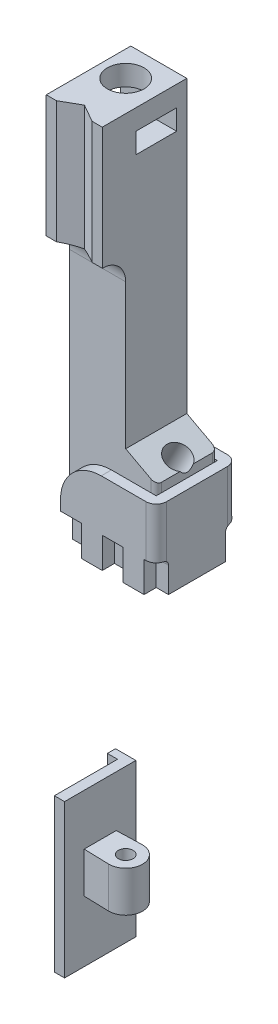
from build123d import *

# Parameters (mm, degrees)
SHUTTLECHANNELOUTLINE_W                = 2.75
SHUTTLECHANNELOUTLINE_H                = 4
SHUTTLECHANNELBODY_EXTRUDE_DEPTH       = 14
SKETCH23_R                             = 0.425
SHUTTLECHANNELCAP_EXTRUDE1_DEPTH       = 1
SKETCH22_RX                            = 1.3
SKETCH22_RY                            = 0.65
SHUTTLECHANNELCAP_EXTRUDE2_DEPTH       = 0.5
SKETCH24_R                             = 0.65
SHUTTLECHANNELCAP_EXTRUDE3_DEPTH       = 0.5
SKETCH26_R                             = 0.25
SHUTTLECHANNELCAP_INJECTIONHOLE_DEPTH  = 24.992186228
CHANNEL_CUT_EXTRUDE12_DEPTH            = 14
CHANNEL_CUT_EXTRUDE12_DEPTH_BACK       = 5
BOSS_EXTRUDE1_DEPTH                    = 4
SKETCH31_W                             = 4.25
SKETCH31_H                             = 0.5
CUT_EXTRUDE3_DEPTH                     = 18.036725037
SKETCH29_W                             = 2.75
SKETCH29_H                             = 5
BOSS_EXTRUDE2_DEPTH                    = 1.15
SKETCH49_W                             = 2.75
SKETCH49_H                             = 4.15
SKETCH49_R                             = 0.9
BOSS_EXTRUDE10_DEPTH                   = 1
FILLET2_R                              = 1.15
SKETCH51_W                             = 2
SKETCH51_H                             = 1
CUT_EXTRUDE8_DEPTH                     = 26.251683112
CUT_EXTRUDE9_DEPTH                     = 19.063014699
SKETCH37_R                             = 0.375
SHUTTLEPLUG_DEPTH                      = 1.5
SKETCH38_W                             = 4.2
SKETCH38_H                             = 3
BOSS_EXTRUDE7_DEPTH                    = 0.5
BOSS_EXTRUDE8_DEPTH                    = 4
BOSS_EXTRUDE8_START                    = -1
BOSS_EXTRUDE8_2_DEPTH                  = 2
BOSS_EXTRUDE8_3_DEPTH                  = 2
SKETCH41_W                             = 4.7
SKETCH41_H                             = 4
BOSS_EXTRUDE9_DEPTH                    = 2
SKETCH42_W                             = 1.025
SKETCH42_H                             = 0.6
SKETCH42_W_2                           = 0.6
CUT_EXTRUDE6_DEPTH                     = 1.5
MOUNTINGSCREWTHREADINGHOLE_START       = -3.720588235
MOUNTINGSCREWTHREADINGHOLE_OUTLINE_R   = 0.45
MOUNTINGSCREWTHREADINGHOLE_DEPTH       = 3.720588235
MOUNTINGSCREWTHREADINGHOLE_START_2     = -3.697058824
MOUNTINGSCREWTHREADINGHOLE_2_OUTLINE_R = 0.45
MOUNTINGSCREWTHREADINGHOLE_2_DEPTH     = 1.460392257
MOUNTINGSCREWTHREADINGHOLE_START_3     = 1.3
MOUNTINGSCREWTHREADINGHOLE_3_DEPTH     = 4.7
MOUNTINGSCREWTHREADINGHOLE_START_4     = -2
MOUNTINGSCREWTHREADINGHOLE_4_DEPTH     = 4
MOUNTINGSCREWTHREADINGHOLE_START_5     = 5.25
MOUNTINGSCREWTHREADINGHOLE_5_DEPTH     = 4
MOUNTINGSCREWTHREADINGHOLE_START_6     = 5.244117647
MOUNTINGSCREWTHREADINGHOLE_6_OUTLINE_R = 0.45
MOUNTINGSCREWTHREADINGHOLE_6_DEPTH     = 3.741176471
SKETCH47_R                             = 0.5969
MOUNTINGSCREWTHROUGHHOLE_DEPTH         = 10
SKETCH32_R                             = 0.36
SHUTTLESLIDERFORTHREADING_DEPTH        = 2
SKETCH33_W                             = 3.5
SKETCH33_H                             = 7.5
SHUTTLEBODY_DEPTH                      = 0.5
SKETCH34_W                             = 0.4
SKETCH34_H                             = 7.5
ALIGNMENTRIDGE_DEPTH                   = 0.5
SKETCH50_R                             = 0.45
CUT_EXTRUDE7_DEPTH                     = 0.6


with BuildPart() as part:
    # ShuttleChannelOutline → ShuttleChannelBody-Extrude (new body)
    with BuildSketch(Plane(origin=(34.00679446, 7.75, 0), x_dir=(-1, 0, 0), z_dir=(0, -1, 0))):
        with Locations((31.38179446, 0)):
            Rectangle(SHUTTLECHANNELOUTLINE_W, SHUTTLECHANNELOUTLINE_H)
    extrude(amount=-SHUTTLECHANNELBODY_EXTRUDE_DEPTH)

    # Sketch23 → ShuttleChannelCap-Extrude1 (add)
    with BuildSketch(Plane(origin=(0, 21.75, 0), x_dir=(0.9959459421984984, 0, -0.08995376711592049), z_dir=(0, 1, 0))):
        Polygon((3.803876235, -2.351706953), (4.163691303, 1.632076816), (1.424839962, 1.879449675), (1.065024894, -2.104334093), align=None)
        with Locations(Location((2.489864855, -0.224884418, 0), (0, 0, 174.839052647))):
            Circle(SKETCH23_R, mode=Mode.SUBTRACT)
    extrude(amount=SHUTTLECHANNELCAP_EXTRUDE1_DEPTH)

    # Sketch22 → ShuttleChannelCap-Extrude2 (add)
    with BuildSketch(Plane(origin=(0, 22.75, 0), x_dir=(0.9908592743397946, 0, -0.13489958656280454), z_dir=(0, 1, 0))):
        Polygon((3.693637924, -2.521316895), (0.96877492, -2.150343032), (1.508373266, 1.813094065), (4.23323627, 1.442120202), align=None)
        with Locations(Location((2.477148186, -0.337248966), (0, 0, 82.247186492))):
            Ellipse(SKETCH22_RX, SKETCH22_RY, mode=Mode.SUBTRACT)
    extrude(amount=SHUTTLECHANNELCAP_EXTRUDE2_DEPTH)

    # Sketch24 → ShuttleChannelCap-Extrude3 (add)
    with BuildSketch(Plane(origin=(0, 23.25, 0), x_dir=(0.9908592743397946, 0, -0.13489958656280476), z_dir=(0, 1, 0))):
        Polygon((3.693637924, -2.521316895), (4.23323627, 1.442120202), (1.508373266, 1.813094066), (0.96877492, -2.150343032), align=None)
        with Locations(Location((2.477148186, -0.337248966, 0), (0, 0, 172.247186492))):
            Circle(SKETCH24_R, mode=Mode.SUBTRACT)
    extrude(amount=SHUTTLECHANNELCAP_EXTRUDE3_DEPTH)

    # Sketch26 → ShuttleChannelCap-InjectionHole (cut, through all)
    with BuildSketch(Plane(origin=(4, 0, 0), x_dir=(0, -0.8752022423708544, -0.4837572066119824), z_dir=(-1, 0, 0))):
        with Locations(Location((-20.129651575, -11.126415752, 0), (0, 0, 208.931080014))):
            Circle(SKETCH26_R)
    extrude(amount=SHUTTLECHANNELCAP_INJECTIONHOLE_DEPTH, mode=Mode.SUBTRACT)

    # ChannelOutline → Channel-Cut-Extrude12 (cut, two sides: drawn at the far end of the back side and taken through both)
    with BuildSketch(Plane(origin=(-34.00679446, 7.75, 0), x_dir=(1, 0, 0), z_dir=(0, 1, 0)).offset(-CHANNEL_CUT_EXTRUDE12_DEPTH_BACK)):
        with BuildLine():
            Line((34.00679446, 0.75), (34.00679446, -0.75))
            Line((34.00679446, -0.75), (36.481932046, -0.824625285))
            ThreePointArc((36.481932046, -0.824625285), (37.33179446, 0), (36.481932046, 0.824625285))
            Line((36.481932046, 0.824625285), (34.00679446, 0.75))
        make_face()
    extrude(amount=CHANNEL_CUT_EXTRUDE12_DEPTH + CHANNEL_CUT_EXTRUDE12_DEPTH_BACK, mode=Mode.SUBTRACT)

    # Sketch27 → Boss-Extrude1 (add)
    with BuildSketch(Plane.XY.offset(2)):
        Polygon((4, 7.75), (5.5, 7.75), (5.5, 9.7), (4, 10.5), align=None)
    extrude(amount=-BOSS_EXTRUDE1_DEPTH)

    # Sketch31 → Cut-Extrude3 (cut, through all)
    with BuildSketch(Plane.XZ.offset(-7.75)):
        with Locations((3.375, 1.75)):
            Rectangle(SKETCH31_W, SKETCH31_H)
        with Locations((3.375, -1.75)):
            Rectangle(SKETCH31_W, SKETCH31_H)
    extrude(amount=-CUT_EXTRUDE3_DEPTH, mode=Mode.SUBTRACT)

    # Sketch29 → Boss-Extrude2 (add)
    with BuildSketch(Plane.XY.offset(1.5)):
        with Locations((2.625, 21.25)):
            Rectangle(SKETCH29_W, SKETCH29_H)
    extrude(amount=BOSS_EXTRUDE2_DEPTH)

    # Sketch49 → Boss-Extrude10 (add)
    with BuildSketch(Plane(origin=(0, 23.75, 0), x_dir=(1, 0, 0), z_dir=(0, 1, 0))):
        with Locations((2.625, -0.575)):
            Rectangle(SKETCH49_W, SKETCH49_H)
        with Locations(Location((2.5, 0, 0), (0, 0, 270))):
            Circle(SKETCH49_R, mode=Mode.SUBTRACT)
    extrude(amount=BOSS_EXTRUDE10_DEPTH)

    # Fillet2
    fillet2_edges = [part.edges().sort_by_distance(p)[0] for p in [
        (2.625, 18.75, 1.5),
    ]]
    fillet(fillet2_edges, radius=FILLET2_R - 0.0001)  # a hair under: the kernel refuses the full size

    # Sketch51 → Cut-Extrude8 (cut, through all)
    with BuildSketch(Plane.ZY.offset(-1.25)):
        with Locations((0, 23.25)):
            Rectangle(SKETCH51_W, SKETCH51_H)
    extrude(amount=-CUT_EXTRUDE8_DEPTH, mode=Mode.SUBTRACT)

    # Sketch52 → Cut-Extrude9 (cut, through all)
    with BuildSketch(Plane(origin=(0, 24.75, 0), x_dir=(1, 0, 0), z_dir=(0, 1, 0))):
        Polygon((1.75, -2.65), (2.625, -2.15), (3.5, -2.65), (2.625, -2.65), align=None)
    extrude(amount=-CUT_EXTRUDE9_DEPTH, mode=Mode.SUBTRACT)

    # Boss-Extrude8: read off the stored shape, not the designer's step
    # Boss-Extrude8 outline → Boss-Extrude8 (cut)
    with BuildSketch(Plane(origin=(0, 7.25, 0), x_dir=(1, 0, 0), z_dir=(0, 1, 0))):
        with BuildLine():
            ThreePointArc((5.25, 1.5), (5.426776695, 1.426776695), (5.5, 1.25))
            Line((5.5, 1.25), (5.5, 1.5))
            Line((5.5, 1.5), (5.25, 1.5))
        make_face()
        with BuildLine():
            ThreePointArc((5.5, -1.25), (5.426776695, -1.426776695), (5.25, -1.5))
            Line((5.25, -1.5), (5.5, -1.5))
            Line((5.5, -1.5), (5.5, -1.25))
        make_face()
    extrude(amount=BOSS_EXTRUDE8_DEPTH, mode=Mode.SUBTRACT)

    # MountingScrewThreadingHole: read off the stored shape, not the designer's step
    # MountingScrewThreadingHole outline → MountingScrewThreadingHole (cut)
    with BuildSketch(Plane(origin=(5.24567474, 9.835640138, 0), x_dir=(0.8823529411764711, -0.470588235294117, 0), z_dir=(0.470588235294117, 0.8823529411764711, 0)).offset(MOUNTINGSCREWTHREADINGHOLE_START)):
        with Locations((-0.211764706, 0)):
            Circle(MOUNTINGSCREWTHREADINGHOLE_OUTLINE_R)
    extrude(amount=MOUNTINGSCREWTHREADINGHOLE_DEPTH, mode=Mode.SUBTRACT)


with BuildPart() as body_2:
    # Sketch37 → ShuttlePlug (new body)
    with BuildSketch(Plane(origin=(0, 7.75, 0), x_dir=(1, 0, 0), z_dir=(0, 1, 0))):
        with BuildLine():
            Line((2.475137585, -0.824625285), (1.25, -0.787687443))
            Line((1.25, -0.787687443), (1.25, 0.787687443))
            Line((1.25, 0.787687443), (2.475137585, 0.824625285))
            ThreePointArc((2.475137585, 0.824625285), (3.325, 0), (2.475137585, -0.824625285))
        make_face()
        with Locations(Location((2.5, 0, 0), (0, 0, 270))):
            Circle(SKETCH37_R, mode=Mode.SUBTRACT)
    extrude(amount=SHUTTLEPLUG_DEPTH)

    # Sketch38 → Boss-Extrude7 (add)
    with BuildSketch(Plane.XZ.offset(-7.75)):
        with Locations((3.4, 0)):
            Rectangle(SKETCH38_W, SKETCH38_H)
    extrude(amount=BOSS_EXTRUDE7_DEPTH)

    # Boss-Extrude8 2 outline → Boss-Extrude8 2 (cut)
    with BuildSketch(Plane(origin=(0, 7.25, 0), x_dir=(1, 0, 0), z_dir=(0, 1, 0)).offset(BOSS_EXTRUDE8_START)):
        with BuildLine():
            Line((5.5, -1.5), (5.5, -1.25))
            ThreePointArc((5.5, -1.25), (5.426776695, -1.426776695), (5.25, -1.5))
            Line((5.25, -1.5), (5.5, -1.5))
        make_face()
        with BuildLine():
            ThreePointArc((5.25, 1.5), (5.426776695, 1.426776695), (5.5, 1.25))
            Line((5.5, 1.25), (5.5, 1.5))
            Line((5.5, 1.5), (5.25, 1.5))
        make_face()
    extrude(amount=BOSS_EXTRUDE8_2_DEPTH, mode=Mode.SUBTRACT)

    # MountingScrewThreadingHole 2 outline → MountingScrewThreadingHole 2 (cut)
    with BuildSketch(Plane(origin=(5.24567474, 9.835640138, 0), x_dir=(0.8823529411764711, -0.470588235294117, 0), z_dir=(0.470588235294117, 0.8823529411764711, 0)).offset(MOUNTINGSCREWTHREADINGHOLE_START_2)):
        with Locations((-0.211764706, 0)):
            Circle(MOUNTINGSCREWTHREADINGHOLE_2_OUTLINE_R)
    extrude(amount=MOUNTINGSCREWTHREADINGHOLE_2_DEPTH, mode=Mode.SUBTRACT)


with BuildPart() as body_3:
    # Boss-Extrude8 3 outline → Boss-Extrude8 3 (new body)
    with BuildSketch(Plane(origin=(0, 7.25, 0), x_dir=(1, 0, 0), z_dir=(0, 1, 0))):
        Polygon((1.3, -1.5), (1.3, -2), (6, -2), (6, 2), (1.3, 2), (1.3, 1.5), (5.5, 1.5), (5.5, -1.5), align=None)
    extrude(amount=BOSS_EXTRUDE8_3_DEPTH)

    # Sketch41 → Boss-Extrude9 (add)
    with BuildSketch(Plane.XZ.offset(-7.25)):
        with Locations((3.65, 0)):
            Rectangle(SKETCH41_W, SKETCH41_H)
    extrude(amount=BOSS_EXTRUDE9_DEPTH)

    # Sketch42 → Cut-Extrude6 (cut)
    with BuildSketch(Plane.XZ.offset(-5.25)):
        with Locations((1.8125, 1.7)):
            Rectangle(SKETCH42_W, SKETCH42_H)
        with Locations((3.8625, -1.7)):
            Rectangle(SKETCH42_W, SKETCH42_H)
        with Locations((1.8125, -1.7)):
            Rectangle(SKETCH42_W, SKETCH42_H)
        with Locations((5.7, -1.7)):
            Rectangle(SKETCH42_W_2, SKETCH42_H)
        with Locations((3.8625, 1.7)):
            Rectangle(SKETCH42_W, SKETCH42_H)
        with Locations((5.7, 1.7)):
            Rectangle(SKETCH42_W_2, SKETCH42_H)
    extrude(amount=-CUT_EXTRUDE6_DEPTH, mode=Mode.SUBTRACT)

    # MountingScrewThreadingHole 3 outline → MountingScrewThreadingHole 3 (add)
    with BuildSketch(Plane.YZ.offset(MOUNTINGSCREWTHREADINGHOLE_START_3)):
        with BuildLine():
            ThreePointArc((6.75, 1.65), (6.676776695, 1.473223305), (6.5, 1.4))
            Line((6.5, 1.4), (6.75, 1.4))
            Line((6.75, 1.4), (6.75, 1.65))
        make_face()
        with BuildLine():
            Line((6.75, -1.4), (6.5, -1.4))
            ThreePointArc((6.5, -1.4), (6.676776695, -1.473223305), (6.75, -1.65))
            Line((6.75, -1.65), (6.75, -1.4))
        make_face()
    extrude(amount=MOUNTINGSCREWTHREADINGHOLE_3_DEPTH)

    # MountingScrewThreadingHole 4 outline → MountingScrewThreadingHole 4 (cut)
    with BuildSketch(Plane.XY.offset(MOUNTINGSCREWTHREADINGHOLE_START_4)):
        with BuildLine():
            ThreePointArc((1.3, 7.25), (1.885786438, 8.664213562), (3.3, 9.25))
            Line((3.3, 9.25), (1.3, 9.25))
            Line((1.3, 9.25), (1.3, 7.25))
        make_face()
    extrude(amount=MOUNTINGSCREWTHREADINGHOLE_4_DEPTH, mode=Mode.SUBTRACT)

    # MountingScrewThreadingHole 5 outline → MountingScrewThreadingHole 5 (cut)
    with BuildSketch(Plane(origin=(0, 0, 0), x_dir=(1, 0, 0), z_dir=(0, 1, 0)).offset(MOUNTINGSCREWTHREADINGHOLE_START_5)):
        with BuildLine():
            Line((6, -2), (6, -1.5))
            ThreePointArc((6, -1.5), (5.853553391, -1.853553391), (5.5, -2))
            Line((5.5, -2), (6, -2))
        make_face()
        with BuildLine():
            ThreePointArc((5.5, 2), (5.853553391, 1.853553391), (6, 1.5))
            Line((6, 1.5), (6, 2))
            Line((6, 2), (5.5, 2))
        make_face()
    extrude(amount=MOUNTINGSCREWTHREADINGHOLE_5_DEPTH, mode=Mode.SUBTRACT)

    # MountingScrewThreadingHole 6 outline → MountingScrewThreadingHole 6 (cut)
    with BuildSketch(Plane(origin=(0, 0, 0), x_dir=(0.882352941176471, -0.47058823529411703, 0), z_dir=(0.470588235294117, 0.882352941176471, 0)).offset(MOUNTINGSCREWTHREADINGHOLE_START_6)):
        with Locations((-0.211764706, 0)):
            Circle(MOUNTINGSCREWTHREADINGHOLE_6_OUTLINE_R)
    extrude(amount=MOUNTINGSCREWTHREADINGHOLE_6_DEPTH, mode=Mode.SUBTRACT)


with BuildPart() as mountingscrewthroughhole_tool:
    # Sketch47 → MountingScrewThroughHole (new body)
    with BuildSketch(Plane(origin=(5.24567474, 9.835640138, 0), x_dir=(0.882352941176471, -0.47058823529411686, 0), z_dir=(0.47058823529411686, 0.882352941176471, 0))):
        with Locations(Location((-0.211764706, 0, 0), (0, 0, 154.35198328))):
            Circle(SKETCH47_R)
    extrude(amount=-MOUNTINGSCREWTHROUGHHOLE_DEPTH)


with BuildPart() as part_1:
    add(part.part)

    # MountingScrewThroughHole: cut by mountingscrewthroughhole_tool
    add(mountingscrewthroughhole_tool.part, mode=Mode.SUBTRACT)


with BuildPart() as body_2_1:
    add(body_2.part)

    # MountingScrewThroughHole: cut by mountingscrewthroughhole_tool
    add(mountingscrewthroughhole_tool.part, mode=Mode.SUBTRACT)


with BuildPart() as body_4:
    # Sketch32 → ShuttleSliderForThreading (new body)
    with BuildSketch(Plane(origin=(0, -10.25, 0), x_dir=(1, 0, 0), z_dir=(0, 1, 0))):
        with BuildLine():
            Line((2.475137585, -0.824625285), (1.25, -0.787687443))
            Line((1.25, -0.787687443), (1.25, -1.75))
            Line((1.25, -1.75), (0.75, -1.75))
            Line((0.75, -1.75), (0.75, 1.75))
            Line((0.75, 1.75), (1.25, 1.75))
            Line((1.25, 1.75), (1.25, 0.787687443))
            Line((1.25, 0.787687443), (2.475137585, 0.824625285))
            ThreePointArc((2.475137585, 0.824625285), (3.325, 0), (2.475137585, -0.824625285))
        make_face()
        with Locations(Location((2.5, 0, 0), (0, 0, 270))):
            Circle(SKETCH32_R, mode=Mode.SUBTRACT)
    extrude(amount=SHUTTLESLIDERFORTHREADING_DEPTH)

    # Sketch33 → ShuttleBody (add)
    with BuildSketch(Plane.ZY.offset(-0.75)):
        with Locations((0, -9.5)):
            Rectangle(SKETCH33_W, SKETCH33_H)
    extrude(amount=-SHUTTLEBODY_DEPTH)

    # Sketch34 → AlignmentRidge (add)
    with BuildSketch(Plane.ZY.offset(-0.75)):
        with Locations((-1.55, -9.5)):
            Rectangle(SKETCH34_W, SKETCH34_H)
    extrude(amount=ALIGNMENTRIDGE_DEPTH)

    # Sketch50 → Cut-Extrude7 (cut)
    with BuildSketch(Plane.XZ.offset(10.25)):
        with Locations(Location((2.5, 0, 0), (0, 0, 270))):
            Circle(SKETCH50_R)
    extrude(amount=-CUT_EXTRUDE7_DEPTH, mode=Mode.SUBTRACT)


solid = Compound([body_3.part, part_1.part, body_2_1.part, body_4.part])
